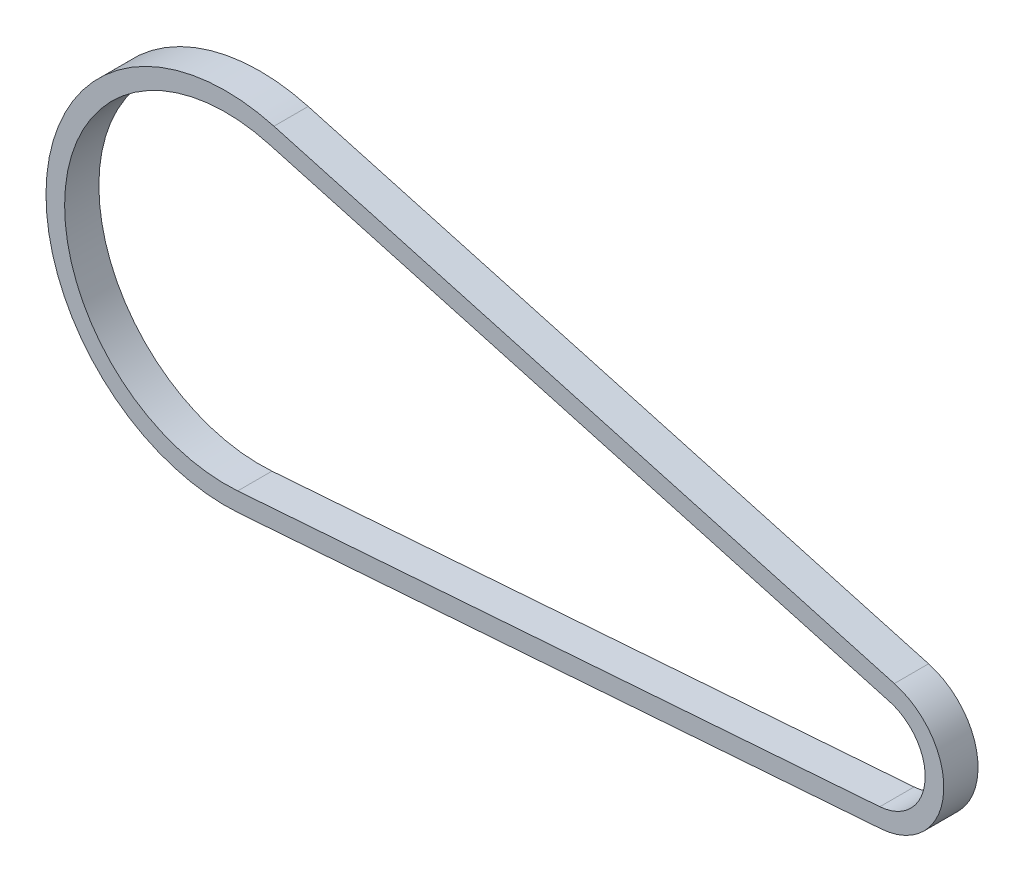
from build123d import *

# Parameters (mm, degrees)
SKETCH3_W = 25.4
SKETCH3_H = 13.8


with BuildPart() as part:
    # Sweep1: sweep along a path in Sketch2
    with BuildLine(Plane.XY) as sweep1_path:
        Line((33.86003419, 121.796767502), (493.886560576, -6.092619308))
        ThreePointArc((493.886560576, -6.092619308), (525.300492459, -51.958667828), (485.509770578, -90.781701911))
        Line((485.509770578, -90.781701911), (9.342960492, -126.070074083))
        ThreePointArc((9.342960492, -126.070074083), (-125.801897746, 12.443352158), (33.86003419, 121.796767502))
    # Sketch3 → Sweep1 (sweep)
    with BuildSketch(Plane(origin=(0, 0, 0), x_dir=(0, 0, -1), z_dir=(1, 0, 0))):
        with Locations((0, 126.415799998)):
            Rectangle(SKETCH3_W, SKETCH3_H)
    sweep(path=sweep1_path.line)


solid = part.part
